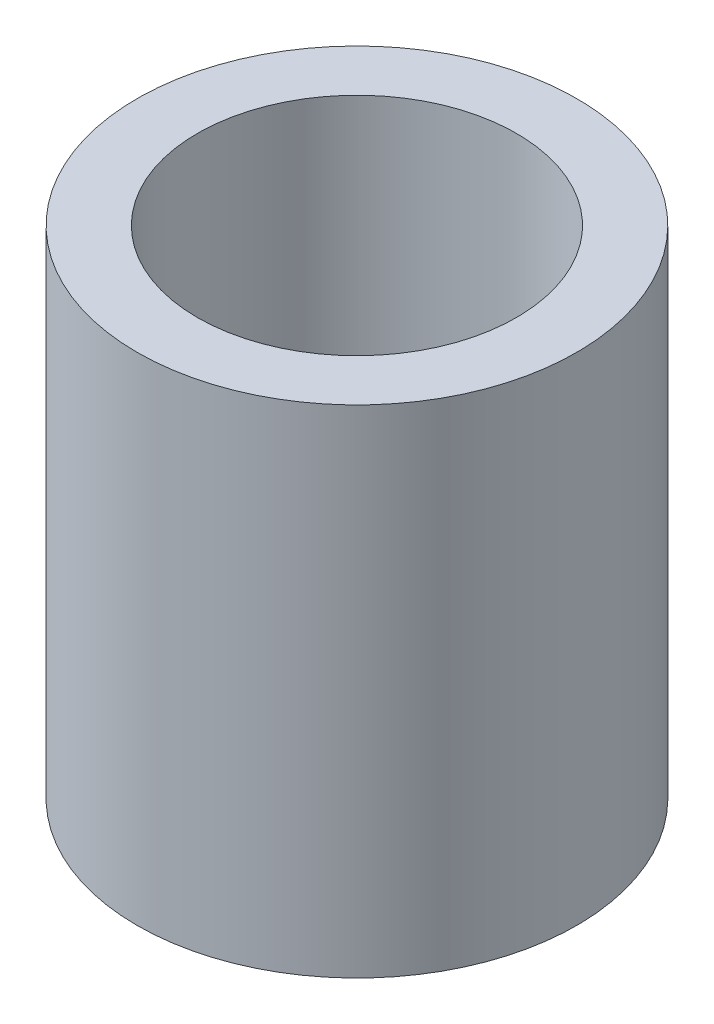
from build123d import *

# Parameters (mm, degrees)
SKETCH1_R           = 3.1
BOSS_EXTRUDE1_DEPTH = 7
SKETCH2_R           = 2.25
CUT_EXTRUDE1_DEPTH  = 7


with BuildPart() as part:
    # Sketch1 → Boss-Extrude1 (new body)
    with BuildSketch(Plane(origin=(0, 0, 0), x_dir=(1, 0, 0), z_dir=(0, 1, 0))):
        Circle(SKETCH1_R)
    extrude(amount=BOSS_EXTRUDE1_DEPTH)

    # Sketch2 → Cut-Extrude1 (cut)
    with BuildSketch(Plane(origin=(0, 7, 0), x_dir=(1, 0, 0), z_dir=(0, 1, 0))):
        Circle(SKETCH2_R)
    extrude(amount=-CUT_EXTRUDE1_DEPTH, mode=Mode.SUBTRACT)


solid = part.part
